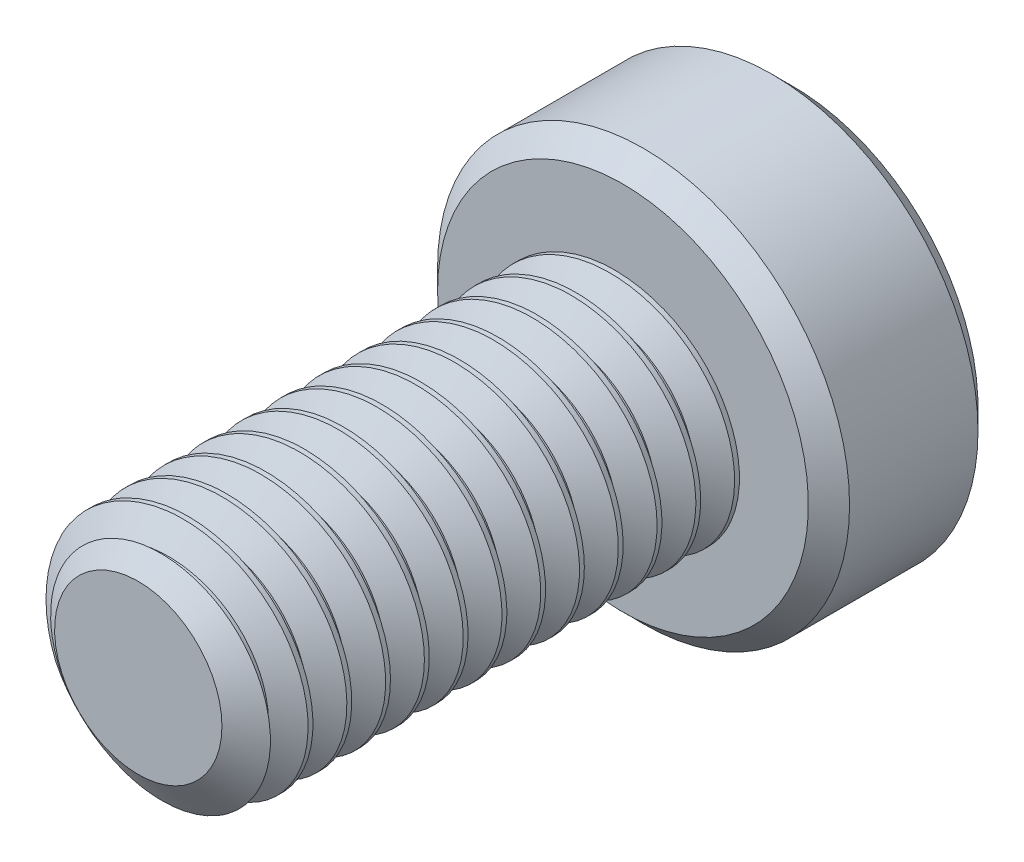
from build123d import *

# Parameters (mm, degrees)
SHAFT_SKETCH_R         = 2.5
SHAFT_EXTRUDE_DEPTH    = 10
THREAD_CUT_SWEEP_PITCH = 0.8
HEAD_SKETCH_R          = 4.25
HEAD_EXTRUDE_DEPTH     = 3.5
SOCKET_CUT_DEPTH       = 2.25
HEAD_EDGE_CHAMFER_SIZE = 0.425


with BuildPart() as part:
    # Shaft Sketch → Shaft Extrude (new body)
    with BuildSketch(Plane.XY):
        Circle(SHAFT_SKETCH_R)
    extrude(amount=-SHAFT_EXTRUDE_DEPTH)

    # Thread Cut Sweep: the profile of Thread Cut Sweep Sketch profile screwed along a right-hand helix of 13.5 turns, 6 arcs to a turn; built about Z, then put on its axis
    thread_cut_sweep_z = Axis((0, 0, 0), (0, 0, 1))
    thread_cut_sweep_corners = [(2.5003, 0, -0.700173205), (1.980384758, 0, -0.4), (1.980384758, 0, -0.3), (2.5003, 0, 0.000173205)]
    with BuildLine(mode=Mode.PRIVATE) as thread_cut_sweep_profile:
        Line(thread_cut_sweep_corners[0], thread_cut_sweep_corners[1])
        Line(thread_cut_sweep_corners[1], thread_cut_sweep_corners[2])
        Line(thread_cut_sweep_corners[2], thread_cut_sweep_corners[3])
        Line(thread_cut_sweep_corners[3], thread_cut_sweep_corners[0])
    thread_cut_sweep_cap = Face(thread_cut_sweep_profile.wire())
    thread_cut_sweep_turn_angles = [0, 30, 60, 90, 120, 150, 180, 210, 240, 270, 300, 330, 360]
    thread_cut_sweep_turn_weights = [1, 0.8660254037844387, 1, 0.8660254037844387, 1, 0.8660254037844387, 1, 0.8660254037844387, 1, 0.8660254037844387, 1, 0.8660254037844387, 1]
    thread_cut_sweep_turn_rails = [Edge.make_bspline([Vector(p[0], p[1], 0).rotate(thread_cut_sweep_z, thread_cut_sweep_turn_angles[k]) / thread_cut_sweep_turn_weights[k] + Vector(0, 0, p[2] + THREAD_CUT_SWEEP_PITCH * thread_cut_sweep_turn_angles[k] / 360) for k in range(13)], [0, 0, 0, 1, 1, 2, 2, 3, 3, 4, 4, 5, 5, 6, 6, 6], 2, thread_cut_sweep_turn_weights) for p in thread_cut_sweep_corners]
    thread_cut_sweep_turn_sides = [Face.make_surface_from_curves(thread_cut_sweep_turn_rails[p[0]], thread_cut_sweep_turn_rails[p[1]]) for p in [(0, 1), (1, 2), (2, 3), (3, 0)]]
    thread_cut_sweep_last_angles = [4680, 4710, 4740, 4770, 4800, 4830, 4860]
    thread_cut_sweep_last_weights = [1, 0.8660254037844387, 1, 0.8660254037844387, 1, 0.8660254037843435, 1]
    thread_cut_sweep_last_rails = [Edge.make_bspline([Vector(p[0], p[1], 0).rotate(thread_cut_sweep_z, thread_cut_sweep_last_angles[k]) / thread_cut_sweep_last_weights[k] + Vector(0, 0, p[2] + THREAD_CUT_SWEEP_PITCH * thread_cut_sweep_last_angles[k] / 360) for k in range(7)], [0, 0, 0, 1, 1, 2, 2, 3, 3, 3], 2, thread_cut_sweep_last_weights) for p in thread_cut_sweep_corners]
    thread_cut_sweep_last_sides = [Face.make_surface_from_curves(thread_cut_sweep_last_rails[p[0]], thread_cut_sweep_last_rails[p[1]]) for p in [(0, 1), (1, 2), (2, 3), (3, 0)]]
    thread_cut_sweep = Plane(origin=(0, 0, 0), x_dir=(0, 1, 0), z_dir=(0, 0, -1)) * Solid(Shell([*[p.moved(Location((0, 0, THREAD_CUT_SWEEP_PITCH * i))) for i in range(13) for p in thread_cut_sweep_turn_sides], *thread_cut_sweep_last_sides, thread_cut_sweep_cap, thread_cut_sweep_cap.rotate(thread_cut_sweep_z, 4860).moved(Location((0, 0, THREAD_CUT_SWEEP_PITCH * 4860 / 360)))]))
    add(thread_cut_sweep, mode=Mode.SUBTRACT)

    # End Chamfer Sketch → End Chamfer Cut Revolve (revolve, cut)
    with BuildSketch(Plane(origin=(0, 0, 0), x_dir=(0, 0, -1), z_dir=(1, 0, 0)), mode=Mode.PRIVATE) as end_chamfer_cut_revolve_sk:
        Polygon((0.541691224, 2.5), (0, 1.726384758), (0, 2.5), align=None)
    revolve(end_chamfer_cut_revolve_sk.sketch.rotate(Axis((0, 0, 0), (0, 0, -1)), 260.43858876), axis=Axis((0, 0, 0), (0, 0, -1)), mode=Mode.SUBTRACT)

    # Head Sketch → Head Extrude (add)
    with BuildSketch(Plane(origin=(0, 0, -10), x_dir=(-1, 0, 0), z_dir=(0, 0, -1))):
        Circle(HEAD_SKETCH_R)
    extrude(amount=HEAD_EXTRUDE_DEPTH)

    # Socket Cut Sketch → Socket Cut (cut)
    with BuildSketch(Plane(origin=(0, 0, -13.5), x_dir=(-1, 0, 0), z_dir=(0, 0, -1))):
        Polygon((0, 1.732050808), (-1.5, 0.866025404), (-1.5, -0.866025404), (0, -1.732050808), (1.5, -0.866025404), (1.5, 0.866025404), align=None)
    extrude(amount=-SOCKET_CUT_DEPTH, mode=Mode.SUBTRACT)

    # Socket Chamfer Extrude cone 1 section (through the dimple's axis) → Socket Chamfer Extrude (revolve, cut)
    with BuildSketch(Plane(origin=(0, 0, -13.5), x_dir=(0, 1, 0), z_dir=(1, 0, 0))):
        Polygon((0, 0), (1.732050808, 0), (0, 1.732050808), align=None)
    revolve(axis=Axis((0, 0, -13.5), (0, 0, 1)), mode=Mode.SUBTRACT)

    # Head Edge Chamfer
    head_edge_chamfer_edges = [part.edges().sort_by_distance(p)[0] for p in [
        (4.25, 0, -10),
        (4.25, 0, -13.5),
    ]]
    chamfer(head_edge_chamfer_edges, length=HEAD_EDGE_CHAMFER_SIZE)


solid = part.part
